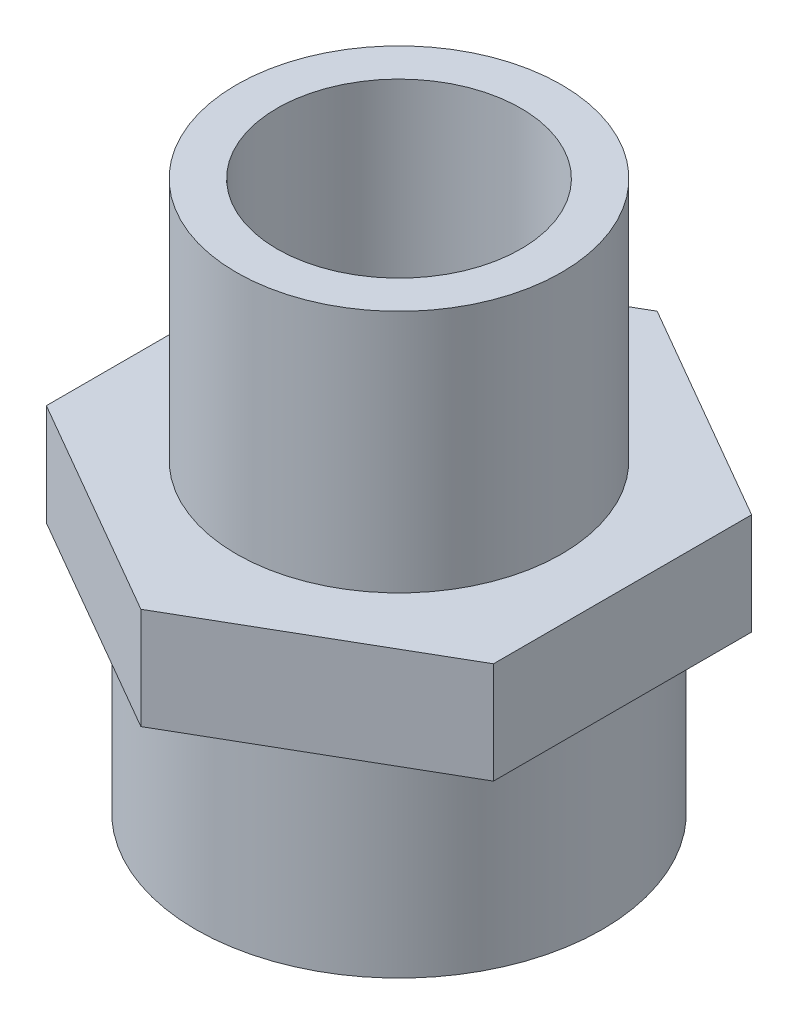
from build123d import *

# Parameters (mm, degrees)
SKETCH1_R           = 10.16
BOSS_EXTRUDE1_DEPTH = 15.24
BOSS_EXTRUDE2_DEPTH = 6.35
SKETCH3_R           = 12.7
BOSS_EXTRUDE3_DEPTH = 12.7
SKETCH4_R           = 7.62
CUT_EXTRUDE1_DEPTH  = 41.387863689


with BuildPart() as part:
    # Sketch1 → Boss-Extrude1 (new body)
    with BuildSketch(Plane(origin=(0, 0, 0), x_dir=(1, 0, 0), z_dir=(0, 1, 0))):
        Circle(SKETCH1_R)
    extrude(amount=BOSS_EXTRUDE1_DEPTH)

    # Sketch2 → Boss-Extrude2 (add)
    with BuildSketch(Plane.XZ):
        Polygon((-13.97, -8.065583261), (0, -16.131166521), (13.97, -8.065583261), (13.97, 8.065583261), (0, 16.131166521), (-13.97, 8.065583261), align=None)
    extrude(amount=BOSS_EXTRUDE2_DEPTH)

    # Sketch3 → Boss-Extrude3 (add)
    with BuildSketch(Plane.XZ.offset(6.35)):
        Circle(SKETCH3_R)
    extrude(amount=BOSS_EXTRUDE3_DEPTH)

    # Sketch4 → Cut-Extrude1 (cut, through all)
    with BuildSketch(Plane(origin=(0, 15.24, 0), x_dir=(1, 0, 0), z_dir=(0, 1, 0))):
        Circle(SKETCH4_R)
    extrude(amount=-CUT_EXTRUDE1_DEPTH, mode=Mode.SUBTRACT)


solid = part.part
